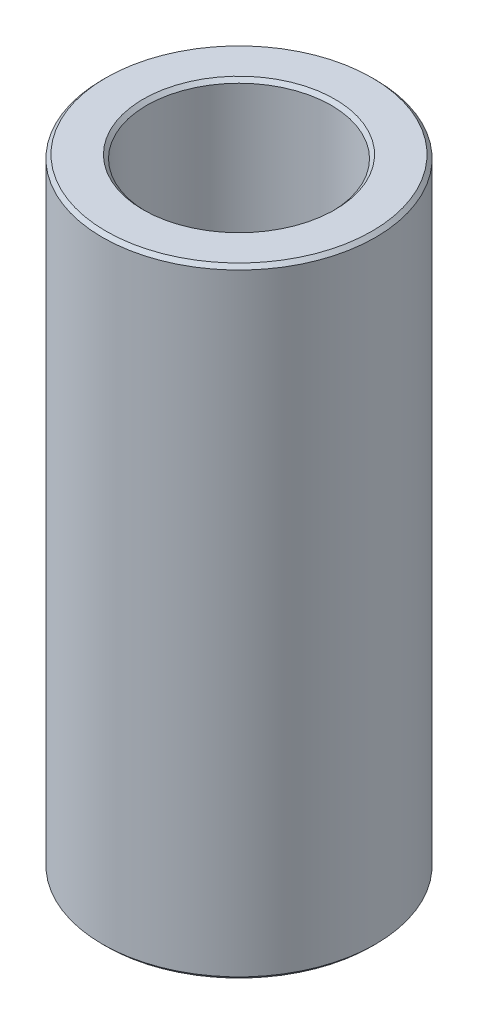
from build123d import *

# Parameters (mm, degrees)
SKETCH1_R           = 25
BOSS_EXTRUDE1_DEPTH = 113.382845756
SKETCH2_R           = 16.899311627
CUT_EXTRUDE1_DEPTH  = 119.767292264
CHAMFER1_SIZE       = 0.654447395


with BuildPart() as part:
    # Sketch1 → Boss-Extrude1 (new body)
    with BuildSketch(Plane(origin=(0, 0, 0), x_dir=(1, 0, 0), z_dir=(0, 1, 0))):
        Circle(SKETCH1_R)
    extrude(amount=BOSS_EXTRUDE1_DEPTH)

    # Sketch2 → Cut-Extrude1 (cut, through all)
    with BuildSketch(Plane(origin=(0, 0, 0), x_dir=(1, 0, 0), z_dir=(0, 1, 0))):
        Circle(SKETCH2_R)
    extrude(amount=CUT_EXTRUDE1_DEPTH, mode=Mode.SUBTRACT)

    # Chamfer1
    chamfer1_edges = [part.edges().sort_by_distance(p)[0] for p in [
        (-16.899311627, 113.382845756, 0),
        (-16.899311627, 0, 0),
        (-25, 0, 0),
        (-25, 113.382845756, 0),
    ]]
    chamfer(chamfer1_edges, length=CHAMFER1_SIZE)


solid = part.part
